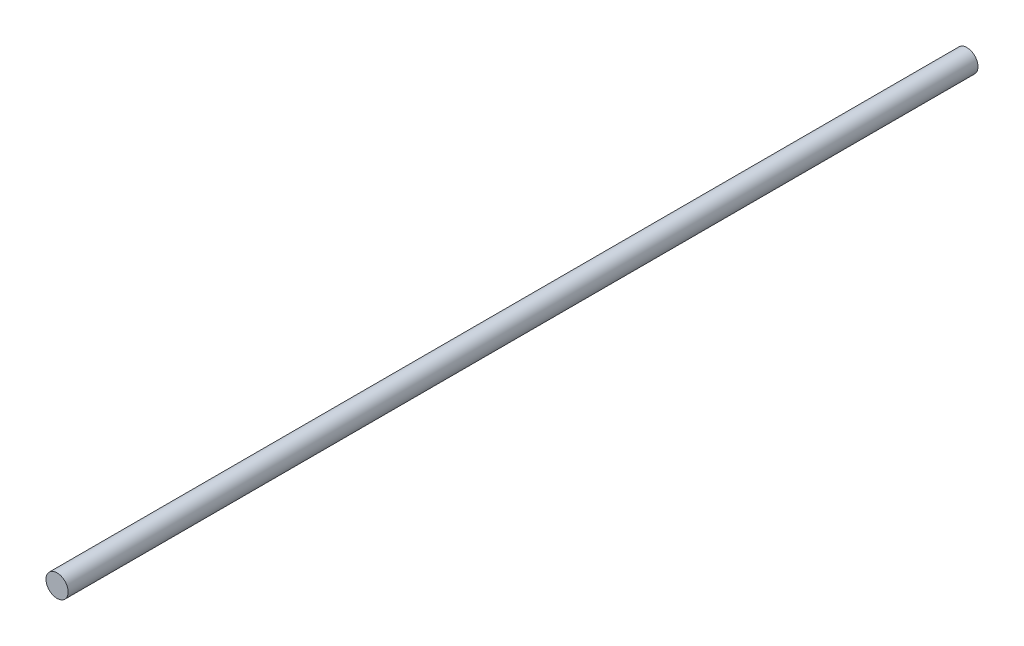
from build123d import *

# Parameters (mm, degrees)
BOSS_EXTRUDE1_DEPTH      = 203.2
BOSS_EXTRUDE1_DEPTH_BACK = 203.2
SKETCH1_R                = 4.953


with BuildPart() as part:
    # Sketch1 → Boss-Extrude1 (new, two sides: drawn at the far end of the back side and taken through both)
    with BuildSketch(Plane.XY.offset(-BOSS_EXTRUDE1_DEPTH_BACK)):
        Circle(SKETCH1_R)
    extrude(amount=BOSS_EXTRUDE1_DEPTH + BOSS_EXTRUDE1_DEPTH_BACK)


solid = part.part
